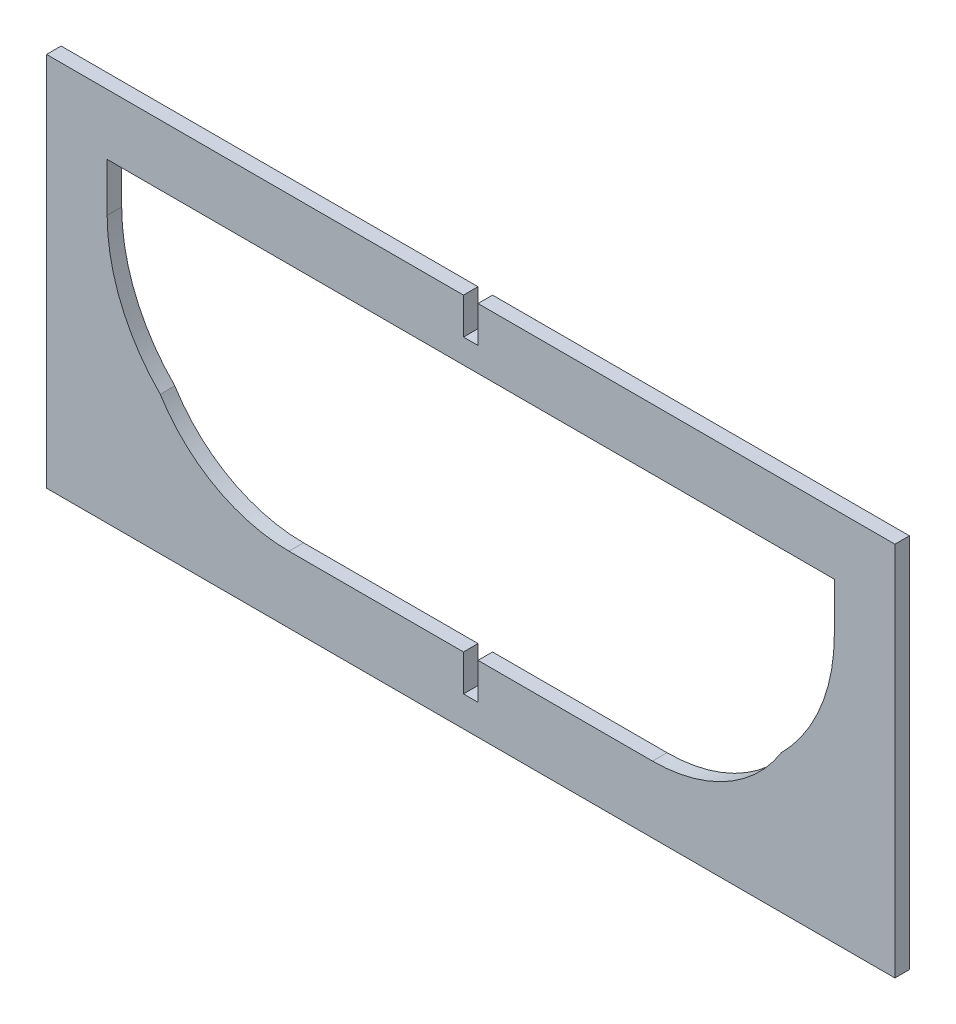
from build123d import *

# Parameters (mm, degrees)
BOSS_EXTRUDE1_DEPTH = 6
SKETCH2_W           = 200
SKETCH2_H           = 25
BOSS_EXTRUDE2_DEPTH = 6
SKETCH3_W           = 100
SKETCH3_H           = 102.5
CUT_EXTRUDE1_DEPTH  = 6
BOSS_EXTRUDE3_DEPTH = 6
SKETCH5_W           = 6
SKETCH5_H           = 15
CUT_EXTRUDE2_DEPTH  = 6


with BuildPart() as part:
    # Sketch1 → Boss-Extrude1 (new body)
    with BuildSketch(Plane.XY):
        with BuildLine():
            Line((-175, 130), (-200, 130))
            Line((-200, 130), (-200, 0))
            Line((-200, 0), (0, 0))
            Line((0, 0), (0, 130))
            Line((0, 130), (-25, 130))
            Line((-25, 130), (-25, 110))
            ThreePointArc((-25, 110), (-30.691670032, 81.340701386), (-46.902810588, 57.03125))
            ThreePointArc((-46.902810588, 57.03125), (-100, 27.5), (-153.097189412, 57.03125))
            ThreePointArc((-153.097189412, 57.03125), (-169.308329968, 81.340701386), (-175, 110))
            Line((-175, 110), (-175, 130))
        make_face()
    extrude(amount=BOSS_EXTRUDE1_DEPTH)

    # Sketch2 → Boss-Extrude2 (add)
    with BuildSketch(Plane.XY.offset(6)):
        with Locations((-100, 142.5)):
            Rectangle(SKETCH2_W, SKETCH2_H)
    extrude(amount=-BOSS_EXTRUDE2_DEPTH)

    # Sketch3 → Cut-Extrude1 (cut)
    with BuildSketch(Plane.XY.offset(6)):
        with Locations((-150, 78.75)):
            Rectangle(SKETCH3_W, SKETCH3_H)
    extrude(amount=-CUT_EXTRUDE1_DEPTH, mode=Mode.SUBTRACT)

    # Sketch4 → Boss-Extrude3 (add)
    with BuildSketch(Plane.XY.offset(6)):
        with BuildLine():
            Line((-200, 27.5), (-250, 27.5))
            ThreePointArc((-250, 27.5), (-280.378472024, 35.379505335), (-303.097189412, 57.03125))
            ThreePointArc((-303.097189412, 57.03125), (-319.308329968, 81.340701386), (-325, 110))
            Line((-325, 110), (-325, 130))
            Line((-325, 130), (-200, 130))
            Line((-200, 130), (-200, 155))
            Line((-200, 155), (-325, 155))
            Line((-325, 155), (-350, 155))
            Line((-350, 155), (-350, 27.5))
            Line((-350, 27.5), (-350, 0))
            Line((-350, 0), (-200, 0))
            Line((-200, 0), (-200, 27.5))
        make_face()
    extrude(amount=-BOSS_EXTRUDE3_DEPTH)

    # Sketch5 → Cut-Extrude2 (cut)
    with BuildSketch(Plane.XY.offset(6)):
        with Locations((-175, 147.5)):
            Rectangle(SKETCH5_W, SKETCH5_H)
        with Locations((-175, 20)):
            Rectangle(SKETCH5_W, SKETCH5_H)
    extrude(amount=-CUT_EXTRUDE2_DEPTH, mode=Mode.SUBTRACT)


solid = part.part
